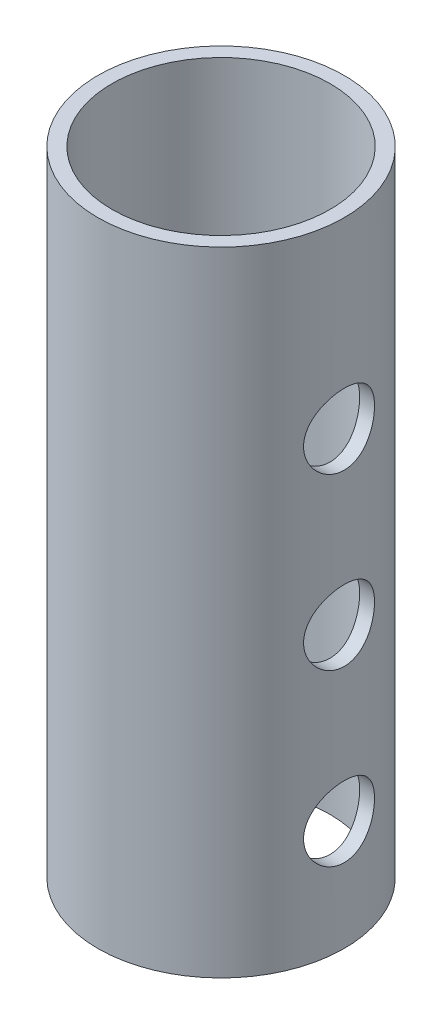
from build123d import *

# Parameters (mm, degrees)
SKETCH1_R           = 43.5
SKETCH1_R_2         = 38.5
BOSS_EXTRUDE1_DEPTH = 223.5
SKETCH2_R           = 12.53
CUT_EXTRUDE1_DEPTH  = 232.811884941
SKETCH4_R           = 7.5
CUT_EXTRUDE2_DEPTH  = 232.811885075


with BuildPart() as part:
    # Sketch1 → Boss-Extrude1 (new body)
    with BuildSketch(Plane(origin=(0, 0, 0), x_dir=(1, 0, 0), z_dir=(0, 1, 0))):
        Circle(SKETCH1_R)
        Circle(SKETCH1_R_2, mode=Mode.SUBTRACT)
    extrude(amount=BOSS_EXTRUDE1_DEPTH)

    # Sketch2 → Cut-Extrude1 (cut, through all)
    with BuildSketch(Plane(origin=(0, 0, 0), x_dir=(0, 0, -1), z_dir=(1, 0, 0))):
        with Locations((0, 158.8)):
            Circle(SKETCH2_R)
        with Locations((0, 98.8)):
            Circle(SKETCH2_R)
        with Locations((0, 38.8)):
            Circle(SKETCH2_R)
    extrude(amount=CUT_EXTRUDE1_DEPTH, mode=Mode.SUBTRACT)

    # Sketch4 → Cut-Extrude2 (cut, through all)
    with BuildSketch(Plane(origin=(0, 0, 0), x_dir=(0, 0, -1), z_dir=(1, 0, 0))):
        with Locations((0, 73.3)):
            Circle(SKETCH4_R)
    extrude(amount=-CUT_EXTRUDE2_DEPTH, mode=Mode.SUBTRACT)


solid = part.part
